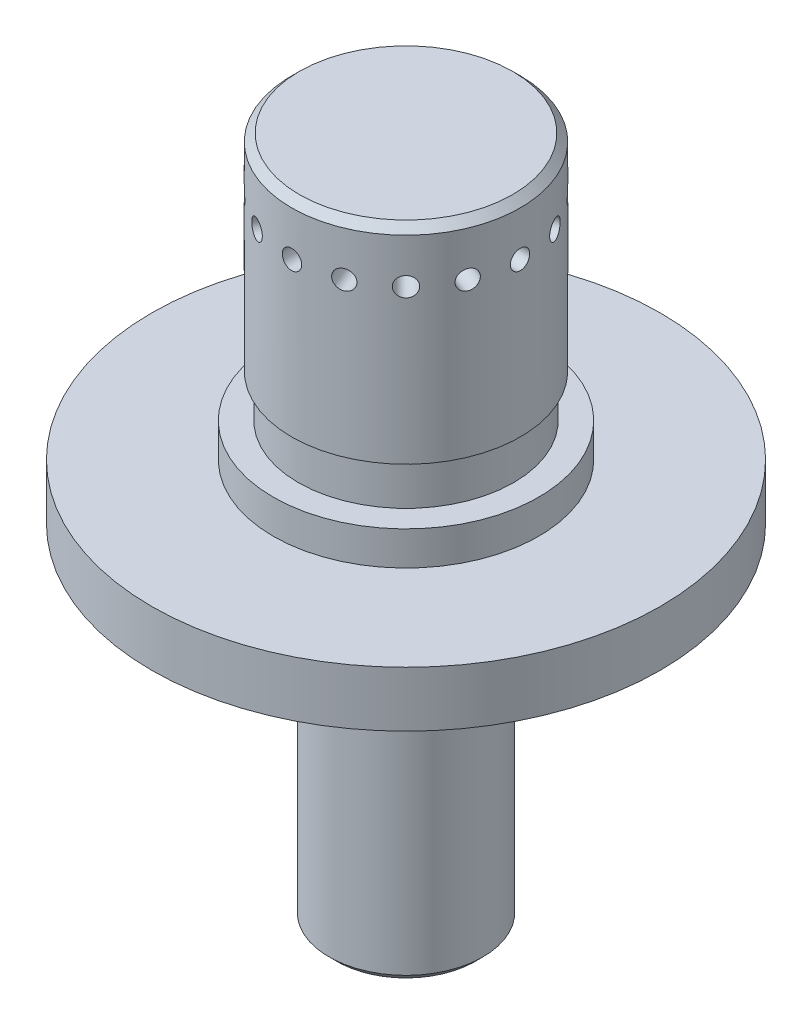
from build123d import *

# Parameters (mm, degrees)
SKETCH14_R             = 2
PIN_HOLES_DEPTH        = 103.834288077
PIN_HOLE_PATTERN_COUNT = 16


with BuildPart() as part:
    # Sketch1 → Bearing Shaft/Flange Support (revolve)
    with BuildSketch(Plane(origin=(0, 0, 0), x_dir=(0, 0, -1), z_dir=(1, 0, 0))):
        Polygon((0, 0), (-27.254672075, 0), (-25.0825, -12.319), (-25.0825, -17.0815), (-15.875, -17.0815), (-15.875, -69.56298), (-14.2875, -71.15048), (0, -71.15048), align=None)
    revolve(axis=Axis((0, 0, 0), (0, 1, 0)))

    # Sketch2 → Drive Pin Support (revolve)
    with BuildSketch(Plane(origin=(0, 0, 0), x_dir=(0, 0, -1), z_dir=(1, 0, 0))):
        Polygon((0, 0), (-52.5, 0), (-52.5, 11.43), (-27.4096, 11.43), (-27.4096, 18.43), (-22.225, 18.43), (-22.225, 27.305), (-23.61946, 27.305), (-23.61946, 68.2625), (-22.03196, 69.85), (0, 69.85), align=None)
    revolve(axis=Axis((0, 0, 0), (0, 1, 0)))

    # Sketch14 → Pin Holes (cut, through all)
    with BuildSketch(Plane(origin=(0, 0, 0), x_dir=(0, 0, -1), z_dir=(1, 0, 0))):
        with Locations((0, 59.05)):
            Circle(SKETCH14_R)
    pin_holes = extrude(amount=-PIN_HOLES_DEPTH, mode=Mode.SUBTRACT)

    # Pin Hole Pattern: Pin Holes ×16 about axis
    pin_hole_pattern_axis = Axis((0, 0, 0), (0, -1, 0))
    for i in range(1, PIN_HOLE_PATTERN_COUNT):
        add(pin_holes.rotate(pin_hole_pattern_axis, i * 360 / PIN_HOLE_PATTERN_COUNT), mode=Mode.SUBTRACT)


solid = part.part
